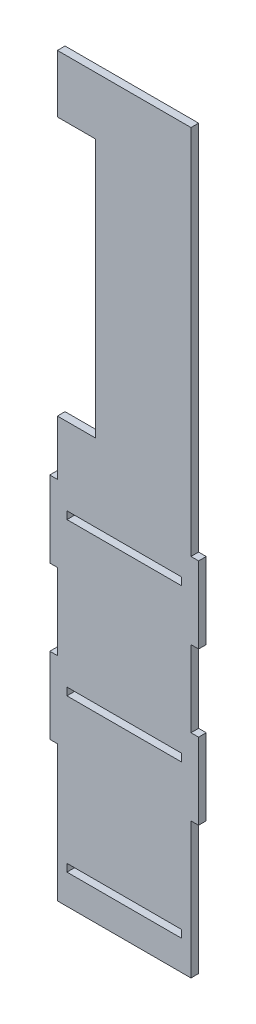
from build123d import *

# Parameters (mm, degrees)
SKETCH_1_W      = 30
SKETCH_1_H      = 2
EXTRUDE_2_DEPTH = 2


with BuildPart() as part:
    # 草图1 → 凸台-拉伸2 (new body)
    with BuildSketch(Plane.XY):
        Polygon((-8, 49), (27, 49), (27, -48.34252785), (29, -48.34252785), (29, -68.34252785), (27, -68.34252785), (27, -88.34252785), (29, -88.34252785), (29, -108.34252785), (27, -108.34252785), (27, -144), (-8, -144), (-8, -108.34252785), (-10, -108.34252785), (-10, -88.34252785), (-8, -88.34252785), (-8, -68.34252785), (-10, -68.34252785), (-10, -48.34252785), (-8, -48.34252785), (-8, -36.9722289), (-8, -33.9722289), (2, -33.9722289), (2, 33.89311496), (-8, 33.89311496), align=None)
        Polygon((9.5, -54.22154055), (24.5, -54.22154055), (24.5, -56.22154055), (-5.5, -56.22154055), (-5.5, -54.22154055), align=None, mode=Mode.SUBTRACT)
        with Locations((9.5, -95.22154055)):
            Rectangle(SKETCH_1_W, SKETCH_1_H, mode=Mode.SUBTRACT)
        with Locations((9.5, -135.22154055)):
            Rectangle(SKETCH_1_W, SKETCH_1_H, mode=Mode.SUBTRACT)
    extrude(amount=EXTRUDE_2_DEPTH)


solid = part.part
